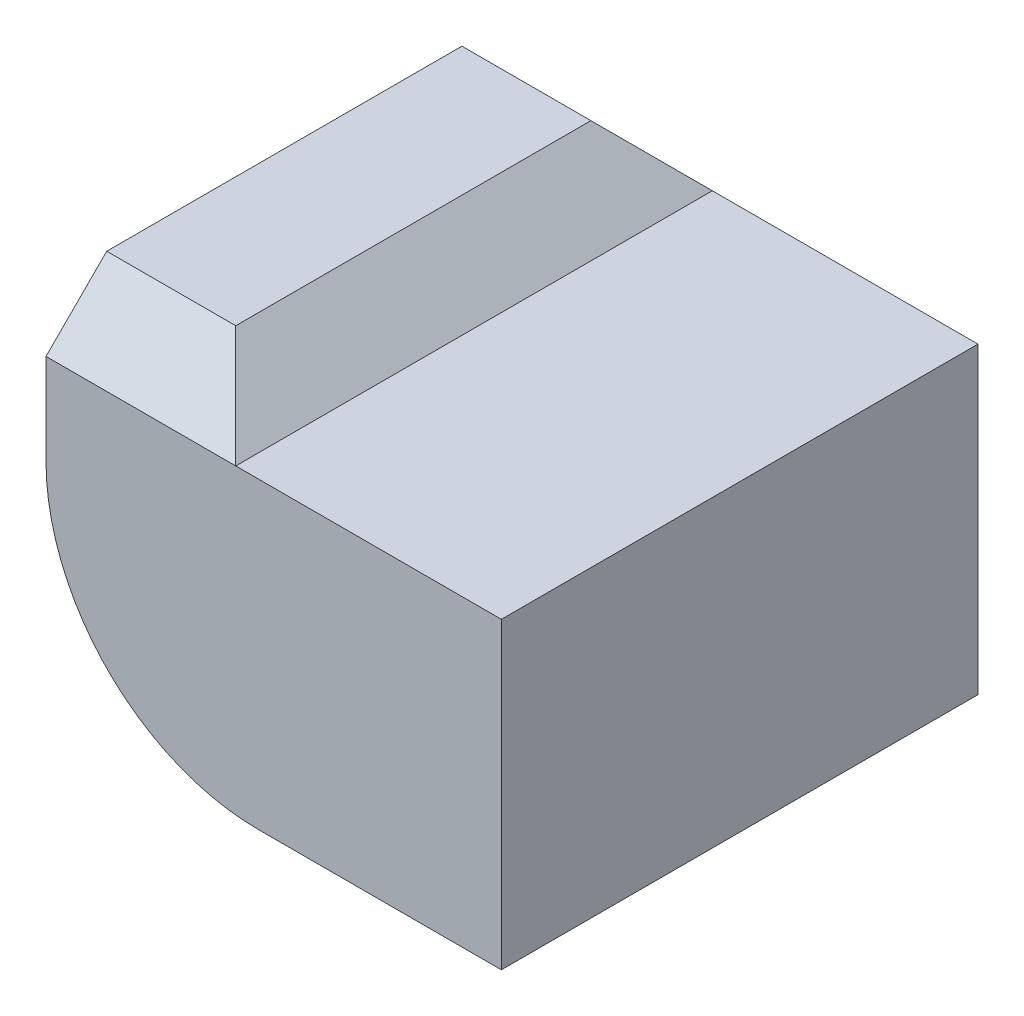
from build123d import *

# Parameters (mm, degrees)
BOSS_EXTRUDE1_DEPTH      = 117
BOSS_EXTRUDE1_DEPTH_BACK = 117
SKETCH1_W                = 350
SKETCH1_H                = 300
BOSS_EXTRUDE2_DEPTH      = 200
BOSS_EXTRUDE2_DEPTH_BACK = 200
CUT_EXTRUDE1_DEPTH       = 540
CUT_EXTRUDE2_DEPTH       = 138
CUT_EXTRUDE2_DEPTH_BACK  = 540
CHAMFER1_SIZE            = 40
CHAMFER2_SIZE            = 40
FILLET1_R                = 140
CUT_EXTRUDE3_DEPTH       = 602.0000000000001
CUT_EXTRUDE4_DEPTH       = 602.0000000000001


with BuildPart() as part:
    # Sketch1 → Boss-Extrude1 (new, two sides: drawn at the far end of the back side and taken through both)
    with BuildSketch(Plane.XY.offset(-BOSS_EXTRUDE1_DEPTH_BACK)):
        Rectangle(SKETCH1_W, SKETCH1_H)
    extrude(amount=BOSS_EXTRUDE1_DEPTH + BOSS_EXTRUDE1_DEPTH_BACK)

    # Sketch3 → Boss-Extrude2 (add, two sides: drawn at the far end of the back side and taken through both)
    with BuildSketch(Plane(origin=(0, 0, 0), x_dir=(-1, 0, 0), z_dir=(0, 0, -1)).offset(-BOSS_EXTRUDE2_DEPTH_BACK)):
        Polygon((-175, 150), (-175, -150), (175, -150), (174.99999999999997, 50.00000000000006), (-75.00000000000003, 50.000000000000014), (-75.00000000000004, 150), align=None)
    extrude(amount=BOSS_EXTRUDE2_DEPTH + BOSS_EXTRUDE2_DEPTH_BACK)

    # Sketch4 → Cut-Extrude1 (cut)
    with BuildSketch(Plane(origin=(0, 0, -117), x_dir=(-1, 0, 0), z_dir=(0, 0, -1))):
        Polygon((174.99999999999997, 150), (-75.00000000000004, 149.99999999999997), (-75.00000000000004, 89.99999999999997), (174.99999999999997, 90), align=None)
    extrude(amount=-CUT_EXTRUDE1_DEPTH, mode=Mode.SUBTRACT)

    # Sketch6 → Cut-Extrude2 (cut, two sides: drawn at the far end of the back side and taken through both)
    with BuildSketch(Plane(origin=(0, 0, -117), x_dir=(-1, 0, 0), z_dir=(0, 0, -1)).offset(-CUT_EXTRUDE2_DEPTH_BACK)):
        Polygon((-188.8193544446854, 158.10037053286104), (89.99999999999997, 158.10037053286104), (89.99999999999997, 50.00000000000004), (-188.8193544446854, 50.00000000000003), align=None)
    extrude(amount=CUT_EXTRUDE2_DEPTH + CUT_EXTRUDE2_DEPTH_BACK, mode=Mode.SUBTRACT)

    # Chamfer1
    chamfer1_edges = [part.edges().sort_by_distance(p)[0] for p in [
        (-89.99999999999997, 50.00000000000004, 0),
    ]]
    chamfer(chamfer1_edges, length=CHAMFER1_SIZE - 0.0001)  # a hair under: the kernel refuses the full size

    # Chamfer2
    chamfer2_edges = [part.edges().sort_by_distance(p)[0] for p in [
        (-112.50004999999997, 50.00000000000004, 117),
        (-112.50004999999997, 50.00000000000004, -117),
    ]]
    chamfer(chamfer2_edges, length=CHAMFER2_SIZE - 0.0001)  # a hair under: the kernel refuses the full size

    # Fillet1
    fillet1_edges = [part.edges().sort_by_distance(p)[0] for p in [
        (-175, -150, 0),
    ]]
    fillet(fillet1_edges, radius=FILLET1_R)

    # Sketch7 → Cut-Extrude3 (cut)
    with BuildSketch(Plane(origin=(0, 0, -200), x_dir=(-1, 0, 0), z_dir=(0, 0, -1))):
        Polygon((-124.99999999999997, 50.00000000000004), (-124.99999999999996, -150), (-196.63418814024195, -174.37612145790905), (-210.87565010922705, 102.36305485317497), align=None)
    extrude(amount=-CUT_EXTRUDE3_DEPTH, mode=Mode.SUBTRACT)

    # Sketch8 → Cut-Extrude4 (cut)
    with BuildSketch(Plane.ZY.offset(174.99999999999997)):
        Polygon((156.99999999999991, 50.00000000000004), (156.99999999999991, -180.65334412999255), (404.27559038441177, -197.1355795745069), (273.0172818180443, 154.636687383358), align=None)
        Polygon((-157.00000000000037, 50.00000000000004), (-157.00000000000037, -188.89446185224972), (-332.7435139552091, -205.02559262419945), (-278.28880023445754, 167.10797834540983), align=None)
    extrude(amount=-CUT_EXTRUDE4_DEPTH, mode=Mode.SUBTRACT)


solid = part.part
